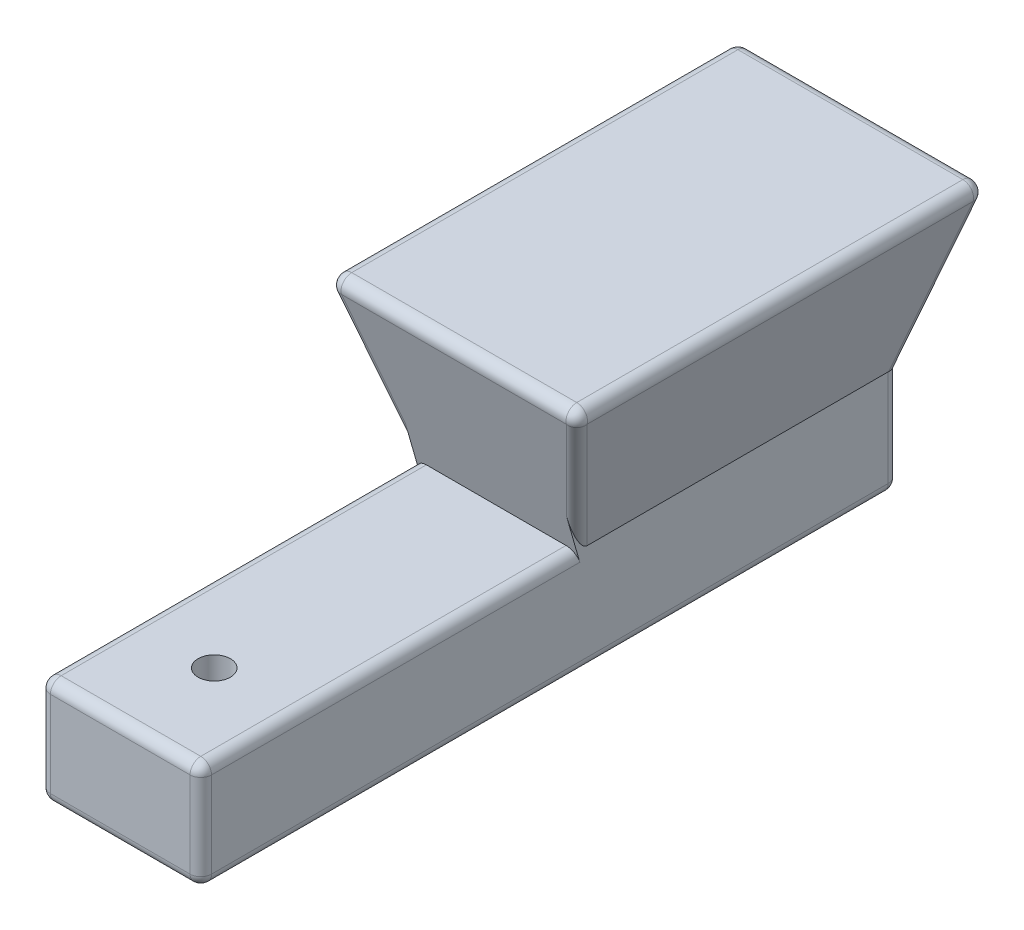
from build123d import *

# Parameters (mm, degrees)
SKETCH2_W           = 15
SKETCH2_H           = 65
BOSS_EXTRUDE1_DEPTH = 10
SKETCH3_R           = 1.5
CUT_EXTRUDE1_DEPTH  = 68.557642573
SKETCH4_W           = 15
SKETCH4_H           = 30
BOSS_EXTRUDE2_DEPTH = 15
BOSS_EXTRUDE2_DRAFT = -16
FILLET1_R           = 1
FILLET2_R           = 1
FILLET3_R           = 1
FILLET4_R           = 1


with BuildPart() as part:
    # Sketch2 → Boss-Extrude1 (new body)
    with BuildSketch(Plane(origin=(0, 0, 0), x_dir=(1, 0, 0), z_dir=(0, 1, 0))):
        with Locations((-29.80941704, 22.926008969)):
            Rectangle(SKETCH2_W, SKETCH2_H)
    extrude(amount=BOSS_EXTRUDE1_DEPTH)

    # Sketch3 → Cut-Extrude1 (cut, through all)
    with BuildSketch(Plane(origin=(0, 10, 0), x_dir=(1, 0, 0), z_dir=(0, 1, 0))):
        with Locations(Location((-29.80941704, -0.823991031, 0), (0, 0, 270))):
            Circle(SKETCH3_R)
    extrude(amount=-CUT_EXTRUDE1_DEPTH, mode=Mode.SUBTRACT)


with BuildPart() as boss_extrude2_tool:
    # Sketch4 → Boss-Extrude2 (with draft: the straight prism first)
    with BuildSketch(Plane(origin=(0, 10, 0), x_dir=(1, 0, 0), z_dir=(0, 1, 0))):
        with Locations((-29.80941704, 40.426008969)):
            Rectangle(SKETCH4_W, SKETCH4_H)
    extrude(amount=BOSS_EXTRUDE2_DEPTH)
    # Boss-Extrude2: the draft: its side faces are tilted about the plane it starts from
    boss_extrude2_sides = [boss_extrude2_tool.faces().sort_by_distance(p)[0] for p in [
        (-37.30941704, 17.5, -40.426008969),
        (-29.80941704, 17.5, -25.426008969),
        (-22.30941704, 17.5, -40.426008969),
        (-29.80941704, 17.5, -55.426008969),
    ]]
    draft(boss_extrude2_sides, Plane(origin=(0, 10, 0), x_dir=(1, 0, 0), z_dir=(0, 1, 0)), BOSS_EXTRUDE2_DRAFT)


with BuildPart() as part_1:
    add(part.part)

    # Boss-Extrude2: add boss_extrude2_tool
    add(boss_extrude2_tool.part)

    # Fillet1
    fillet1_edges = [part_1.edges().sort_by_distance(p)[0] for p in [
        (-22.30941704, 10, -7.926008969),
        (-37.30941704, 10, -7.926008969),
        (-41.610597827, 25, -40.426008969),
        (-29.80941704, 25, -21.124828182),
        (-18.008236254, 25, -40.426008969),
        (-29.80941704, 25, -59.727189755),
        (-29.80941704, 10, 9.573991031),
    ]]
    fillet(fillet1_edges, radius=FILLET1_R)

    # Fillet2
    # the kernel refuses this fillet: 1 mm, written as the material it takes off along each edge
    with BuildSketch(Plane(origin=(-23.30941704, 9, 8.573991031), x_dir=(1, 0, 0), z_dir=(0, 0, 1))) as fillet2_piece_1_section:
        Polygon((0, 0), (FILLET2_R, 0), (FILLET2_R, FILLET2_R), (0, FILLET2_R), align=None)
    fillet2_piece_1 = extrude(amount=FILLET2_R, mode=Mode.PRIVATE)
    fillet2_piece_1 = fillet2_piece_1 - Plane(origin=(-23.30941704, 9, 8.573991031), x_dir=(-0.7071067811865475, -0.7071067811865475, 0), z_dir=(0, 0, 1)) * Sphere(FILLET2_R, mode=Mode.PRIVATE)
    add(fillet2_piece_1, mode=Mode.SUBTRACT)
    with BuildSketch(Plane(origin=(-23.30941704, 1, -54.426008969), x_dir=(1, 0, 0), z_dir=(0, -1, 0))) as fillet2_piece_2_section:
        Polygon((0, 0), (FILLET2_R, 0), (FILLET2_R, -FILLET2_R), (0, -FILLET2_R), align=None)
    fillet2_piece_2 = extrude(amount=FILLET2_R, mode=Mode.PRIVATE)
    fillet2_piece_2 = fillet2_piece_2 - Plane(origin=(-23.30941704, 1, -54.426008969), x_dir=(-0.7071067811865475, 0, 0.7071067811865475), z_dir=(0, -1, 0)) * Sphere(FILLET2_R, mode=Mode.PRIVATE)
    add(fillet2_piece_2, mode=Mode.SUBTRACT)
    with BuildSketch(Plane(origin=(-22.30941704, -2.5, 9.573991031), x_dir=(-1, 0, 0), z_dir=(0, 1, 0))) as fillet2_piece_3:
        with BuildLine():
            CenterArc((FILLET2_R, -FILLET2_R), FILLET2_R, 90, 90)
            Line((0, -FILLET2_R), (0, 0))
            Line((0, 0), (FILLET2_R, 0))
        make_face()
    extrude(amount=11.5, mode=Mode.SUBTRACT)
    with BuildSketch(Plane(origin=(-39.80941704, 0, -55.426008969), x_dir=(0, 1, 0), z_dir=(1, 0, 0))) as fillet2_piece_4:
        with BuildLine():
            CenterArc((FILLET2_R, FILLET2_R), FILLET2_R, 180, 90)
            Line((0, FILLET2_R), (0, 0))
            Line((0, 0), (FILLET2_R, 0))
        make_face()
    extrude(amount=16.5, mode=Mode.SUBTRACT)
    with BuildSketch(Plane(origin=(-22.30941704, 0, -54.426008969), x_dir=(-1, 0, 0), z_dir=(0, 0, 1))) as fillet2_piece_5:
        with BuildLine():
            CenterArc((FILLET2_R, -FILLET2_R), FILLET2_R, 90, 90)
            Line((0, -FILLET2_R), (0, 0))
            Line((0, 0), (FILLET2_R, 0))
        make_face()
    extrude(amount=66.5, mode=Mode.SUBTRACT)
    with BuildSketch(Plane(origin=(-37.30941704, -2.5, -55.426008969), x_dir=(0, 0, 1), z_dir=(0, 1, 0))) as fillet2_piece_6_section:
        with BuildLine():
            CenterArc((FILLET2_R, FILLET2_R), FILLET2_R, 180, 90)
            Line((0, FILLET2_R), (0, 0))
            Line((0, 0), (FILLET2_R, 0))
        make_face()
    fillet2_piece_6 = extrude(amount=15, mode=Mode.PRIVATE)
    fillet2_piece_6 = split(fillet2_piece_6, bisect_by=Plane(origin=(-33.997421639, -1.550300601, -55.426008969), z_dir=(-0.9612616959383189, -0.2756373558169994, 0)), keep=Keep.TOP, mode=Mode.PRIVATE)
    fillet2_piece_6 = split(fillet2_piece_6, bisect_by=Plane(origin=(-37.30941704, -1.550300601, -52.114013567), z_dir=(0, -0.2756373558169994, -0.9612616959383189)), keep=Keep.TOP, mode=Mode.PRIVATE)
    add(fillet2_piece_6, mode=Mode.SUBTRACT)
    with BuildSketch(Plane(origin=(-37.30941704, -2.5, -55.426008969), x_dir=(0, 0, 1), z_dir=(0, 1, 0))) as fillet2_piece_7_section:
        with BuildLine():
            CenterArc((FILLET2_R, FILLET2_R), FILLET2_R, 180, 90)
            Line((0, FILLET2_R), (0, 0))
            Line((0, 0), (FILLET2_R, 0))
        make_face()
    fillet2_piece_7 = extrude(amount=15, mode=Mode.PRIVATE)
    fillet2_piece_7 = split(fillet2_piece_7, bisect_by=Plane(origin=(-33.997421639, -1.550300601, -55.426008969), z_dir=(0.9612616959383189, 0.2756373558169994, 0)), keep=Keep.TOP, mode=Mode.PRIVATE)
    fillet2_piece_7 = split(fillet2_piece_7, bisect_by=Plane(origin=(-37.30941704, -1.550300601, -52.114013567), z_dir=(0, -0.2756373558169994, -0.9612616959383189)), keep=Keep.TOP, mode=Mode.PRIVATE)
    add(fillet2_piece_7, mode=Mode.SUBTRACT)
    with BuildSketch(Plane(origin=(-37.30941704, -2.5, -55.426008969), x_dir=(0, 0, 1), z_dir=(0, 1, 0))) as fillet2_piece_8_section:
        with BuildLine():
            CenterArc((FILLET2_R, FILLET2_R), FILLET2_R, 180, 90)
            Line((0, FILLET2_R), (0, 0))
            Line((0, 0), (FILLET2_R, 0))
        make_face()
    fillet2_piece_8 = extrude(amount=15, mode=Mode.PRIVATE)
    fillet2_piece_8 = split(fillet2_piece_8, bisect_by=Plane(origin=(-33.997421639, -1.550300601, -55.426008969), z_dir=(-0.9612616959383189, -0.2756373558169994, 0)), keep=Keep.TOP, mode=Mode.PRIVATE)
    fillet2_piece_8 = split(fillet2_piece_8, bisect_by=Plane(origin=(-37.30941704, -1.550300601, -52.114013567), z_dir=(0, 0.2756373558169994, 0.9612616959383189)), keep=Keep.TOP, mode=Mode.PRIVATE)
    add(fillet2_piece_8, mode=Mode.SUBTRACT)
    with BuildSketch(Plane(origin=(-22.30941704, 1, -55.426008969), x_dir=(-1, 0, 0), z_dir=(0, 1, 0))) as fillet2_piece_9_section:
        with BuildLine():
            CenterArc((FILLET2_R, FILLET2_R), FILLET2_R, 180, 90)
            Line((0, FILLET2_R), (0, 0))
            Line((0, 0), (FILLET2_R, 0))
        make_face()
    fillet2_piece_9 = extrude(amount=11.5, mode=Mode.PRIVATE)
    fillet2_piece_9 = split(fillet2_piece_9, bisect_by=Plane(origin=(-22.30941704, 1.683783567, -53.04137228), z_dir=(0, -0.2756373558169994, -0.9612616959383189)), keep=Keep.TOP, mode=Mode.PRIVATE)
    fillet2_piece_9 = split(fillet2_piece_9, bisect_by=Plane(origin=(-24.694053729, 1.683783567, -55.426008969), z_dir=(0.9612616959383189, -0.2756373558169994, 0)), keep=Keep.TOP, mode=Mode.PRIVATE)
    add(fillet2_piece_9, mode=Mode.SUBTRACT)
    with BuildSketch(Plane(origin=(-22.30941704, 1, -55.426008969), x_dir=(-1, 0, 0), z_dir=(0, 1, 0))) as fillet2_piece_10_section:
        with BuildLine():
            CenterArc((FILLET2_R, FILLET2_R), FILLET2_R, 180, 90)
            Line((0, FILLET2_R), (0, 0))
            Line((0, 0), (FILLET2_R, 0))
        make_face()
    fillet2_piece_10 = extrude(amount=11.5, mode=Mode.PRIVATE)
    fillet2_piece_10 = split(fillet2_piece_10, bisect_by=Plane(origin=(-22.30941704, 1.683783567, -53.04137228), z_dir=(0, 0.2756373558169994, 0.9612616959383189)), keep=Keep.TOP, mode=Mode.PRIVATE)
    fillet2_piece_10 = split(fillet2_piece_10, bisect_by=Plane(origin=(-24.694053729, 1.683783567, -55.426008969), z_dir=(0.9612616959383189, -0.2756373558169994, 0)), keep=Keep.TOP, mode=Mode.PRIVATE)
    add(fillet2_piece_10, mode=Mode.SUBTRACT)
    with BuildSketch(Plane(origin=(-22.30941704, 1, -55.426008969), x_dir=(-1, 0, 0), z_dir=(0, 1, 0))) as fillet2_piece_11_section:
        with BuildLine():
            CenterArc((FILLET2_R, FILLET2_R), FILLET2_R, 180, 90)
            Line((0, FILLET2_R), (0, 0))
            Line((0, 0), (FILLET2_R, 0))
        make_face()
    fillet2_piece_11 = extrude(amount=11.5, mode=Mode.PRIVATE)
    fillet2_piece_11 = split(fillet2_piece_11, bisect_by=Plane(origin=(-22.30941704, 1.683783567, -53.04137228), z_dir=(0, -0.2756373558169994, -0.9612616959383189)), keep=Keep.TOP, mode=Mode.PRIVATE)
    fillet2_piece_11 = split(fillet2_piece_11, bisect_by=Plane(origin=(-24.694053729, 1.683783567, -55.426008969), z_dir=(-0.9612616959383189, 0.2756373558169994, 0)), keep=Keep.TOP, mode=Mode.PRIVATE)
    add(fillet2_piece_11, mode=Mode.SUBTRACT)

    # Fillet3
    # the kernel refuses this fillet: 1 mm, written as the material it takes off along each edge
    with BuildSketch(Plane(origin=(-36.30941704, 9, 8.573991031), x_dir=(-1, 0, 0), z_dir=(0, 0, 1))) as fillet3_piece_1_section:
        Polygon((0, 0), (FILLET3_R, 0), (FILLET3_R, -FILLET3_R), (0, -FILLET3_R), align=None)
    fillet3_piece_1 = extrude(amount=FILLET3_R, mode=Mode.PRIVATE)
    fillet3_piece_1 = fillet3_piece_1 - Plane(origin=(-36.30941704, 9, 8.573991031), x_dir=(0.7071067811865475, -0.7071067811865475, 0), z_dir=(0, 0, 1)) * Sphere(FILLET3_R, mode=Mode.PRIVATE)
    add(fillet3_piece_1, mode=Mode.SUBTRACT)
    with BuildSketch(Plane(origin=(-36.30941704, 1, -54.426008969), x_dir=(-1, 0, 0), z_dir=(0, -1, 0))) as fillet3_piece_2_section:
        Polygon((0, 0), (FILLET3_R, 0), (FILLET3_R, FILLET3_R), (0, FILLET3_R), align=None)
    fillet3_piece_2 = extrude(amount=FILLET3_R, mode=Mode.PRIVATE)
    fillet3_piece_2 = fillet3_piece_2 - Plane(origin=(-36.30941704, 1, -54.426008969), x_dir=(0.7071067811865475, 0, 0.7071067811865475), z_dir=(0, -1, 0)) * Sphere(FILLET3_R, mode=Mode.PRIVATE)
    add(fillet3_piece_2, mode=Mode.SUBTRACT)
    with BuildSketch(Plane(origin=(-23.30941704, 1, 8.573991031), x_dir=(0, 0, 1), z_dir=(0, -1, 0))) as fillet3_piece_3_section:
        Polygon((0, 0), (FILLET3_R, 0), (FILLET3_R, -FILLET3_R), (0, -FILLET3_R), align=None)
    fillet3_piece_3 = extrude(amount=FILLET3_R, mode=Mode.PRIVATE)
    fillet3_piece_3 = fillet3_piece_3 - Plane(origin=(-23.30941704, 1, 8.573991031), x_dir=(-0.7071067811865476, 0, -0.7071067811865475), z_dir=(0, -1, 0)) * Sphere(FILLET3_R, mode=Mode.PRIVATE)
    add(fillet3_piece_3, mode=Mode.SUBTRACT)
    with BuildSketch(Plane(origin=(-36.30941704, 1, 8.573991031), x_dir=(0, 0, 1), z_dir=(-1, 0, 0))) as fillet3_piece_4_section:
        Polygon((0, 0), (FILLET3_R, 0), (FILLET3_R, -FILLET3_R), (0, -FILLET3_R), align=None)
    fillet3_piece_4 = extrude(amount=FILLET3_R, mode=Mode.PRIVATE)
    fillet3_piece_4 = fillet3_piece_4 - Plane(origin=(-36.30941704, 1, 8.573991031), x_dir=(0, 0.7071067811865475, -0.7071067811865475), z_dir=(-1, 0, 0)) * Sphere(FILLET3_R, mode=Mode.PRIVATE)
    add(fillet3_piece_4, mode=Mode.SUBTRACT)
    with BuildSketch(Plane(origin=(-37.30941704, 1, 9.573991031), x_dir=(1, 0, 0), z_dir=(0, 1, 0))) as fillet3_piece_5:
        with BuildLine():
            CenterArc((FILLET3_R, FILLET3_R), FILLET3_R, 180, 90)
            Line((0, FILLET3_R), (0, 0))
            Line((0, 0), (FILLET3_R, 0))
        make_face()
    extrude(amount=8, mode=Mode.SUBTRACT)
    with BuildSketch(Plane(origin=(-23.30941704, 0, 9.573991031), x_dir=(0, 0, -1), z_dir=(-1, 0, 0))) as fillet3_piece_6:
        with BuildLine():
            CenterArc((FILLET3_R, -FILLET3_R), FILLET3_R, 90, 90)
            Line((0, -FILLET3_R), (0, 0))
            Line((0, 0), (FILLET3_R, 0))
        make_face()
    extrude(amount=13, mode=Mode.SUBTRACT)
    with BuildSketch(Plane(origin=(-37.30941704, 0, 8.573991031), x_dir=(1, 0, 0), z_dir=(0, 0, -1))) as fillet3_piece_7:
        with BuildLine():
            CenterArc((FILLET3_R, -FILLET3_R), FILLET3_R, 90, 90)
            Line((0, -FILLET3_R), (0, 0))
            Line((0, 0), (FILLET3_R, 0))
        make_face()
    extrude(amount=63, mode=Mode.SUBTRACT)

    # Fillet4
    # the kernel refuses this fillet: 1 mm, written as the material it takes off along each edge
    with BuildSketch(Plane(origin=(-19.335281076, 24, -58.400144933), x_dir=(-0.586629189217781, 0.7784832277628361, -0.22322647345161653), z_dir=(0.6714721557028178, 0.31344902014780923, -0.6714721557028178))) as fillet4_piece_1_section:
        Polygon((-2.551826428, -2.551826428), (2.551826428, -2.551826428), (2.551826428, 2.551826428), (-2.551826428, 2.551826428), align=None)
    fillet4_piece_1 = extrude(amount=2.551826428, mode=Mode.PRIVATE)
    fillet4_piece_1 = split(fillet4_piece_1, bisect_by=Plane(origin=(-19.335281076, 24, -58.400144933), z_dir=(0.265727678029987, 0.9267025424900824, -0.265727678029987)), keep=Keep.TOP, mode=Mode.PRIVATE)
    fillet4_piece_1 = split(fillet4_piece_1, bisect_by=Plane(origin=(-19.335281076, 24, -58.400144933), z_dir=(0, 0, -1)), keep=Keep.TOP, mode=Mode.PRIVATE)
    fillet4_piece_1 = split(fillet4_piece_1, bisect_by=Plane(origin=(-19.335281076, 24, -58.400144933), z_dir=(1, 0, 0)), keep=Keep.TOP, mode=Mode.PRIVATE)
    fillet4_piece_1 = split(fillet4_piece_1, bisect_by=Plane(origin=(-19.335281076, 23.724362644, -59.361406629), z_dir=(0, 0.2756373558169994, 0.9612616959383189)), keep=Keep.TOP, mode=Mode.PRIVATE)
    fillet4_piece_1 = split(fillet4_piece_1, bisect_by=Plane(origin=(-18.37401938, 23.724362644, -58.400144933), z_dir=(-0.9612616959383189, 0.2756373558169994, 0)), keep=Keep.TOP, mode=Mode.PRIVATE)
    fillet4_piece_1 = split(fillet4_piece_1, bisect_by=Plane(origin=(-19.335281076, 25, -58.400144933), z_dir=(0, -1, 0)), keep=Keep.TOP, mode=Mode.PRIVATE)
    fillet4_piece_1 = fillet4_piece_1 - Plane(origin=(-19.335281076, 24, -58.400144933), x_dir=(-0.6714721557028178, -0.31344902014780923, 0.6714721557028178), z_dir=(-0.586629189217781, 0.7784832277628361, -0.22322647345161653)) * Sphere(FILLET4_R, mode=Mode.PRIVATE)
    add(fillet4_piece_1, mode=Mode.SUBTRACT)
    with BuildSketch(Plane(origin=(-19.335281076, 24, -22.451873004), x_dir=(0.586629189217781, -0.7784832277628361, -0.22322647345161653), z_dir=(0.6714721557028178, 0.31344902014780923, 0.6714721557028178))) as fillet4_piece_2_section:
        Polygon((-2.551826428, -2.551826428), (2.551826428, -2.551826428), (2.551826428, 2.551826428), (-2.551826428, 2.551826428), align=None)
    fillet4_piece_2 = extrude(amount=2.551826428, mode=Mode.PRIVATE)
    fillet4_piece_2 = split(fillet4_piece_2, bisect_by=Plane(origin=(-19.335281076, 24, -22.451873004), z_dir=(0.265727678029987, 0.9267025424900824, 0.265727678029987)), keep=Keep.TOP, mode=Mode.PRIVATE)
    fillet4_piece_2 = split(fillet4_piece_2, bisect_by=Plane(origin=(-19.335281076, 24, -22.451873004), z_dir=(0, 0, 1)), keep=Keep.TOP, mode=Mode.PRIVATE)
    fillet4_piece_2 = split(fillet4_piece_2, bisect_by=Plane(origin=(-19.335281076, 24, -22.451873004), z_dir=(1, 0, 0)), keep=Keep.TOP, mode=Mode.PRIVATE)
    fillet4_piece_2 = split(fillet4_piece_2, bisect_by=Plane(origin=(-19.335281076, 23.724362644, -21.490611308), z_dir=(0, 0.2756373558169994, -0.9612616959383189)), keep=Keep.TOP, mode=Mode.PRIVATE)
    fillet4_piece_2 = split(fillet4_piece_2, bisect_by=Plane(origin=(-18.37401938, 23.724362644, -22.451873004), z_dir=(-0.9612616959383189, 0.2756373558169994, 0)), keep=Keep.TOP, mode=Mode.PRIVATE)
    fillet4_piece_2 = split(fillet4_piece_2, bisect_by=Plane(origin=(-19.335281076, 25, -22.451873004), z_dir=(0, -1, 0)), keep=Keep.TOP, mode=Mode.PRIVATE)
    fillet4_piece_2 = fillet4_piece_2 - Plane(origin=(-19.335281076, 24, -22.451873004), x_dir=(-0.6714721557028178, -0.31344902014780923, -0.6714721557028178), z_dir=(0.586629189217781, -0.7784832277628361, -0.22322647345161653)) * Sphere(FILLET4_R, mode=Mode.PRIVATE)
    add(fillet4_piece_2, mode=Mode.SUBTRACT)
    with BuildSketch(Plane(origin=(-40.283553005, 24, -22.451873004), x_dir=(0.22322647345161664, -0.7784832277628361, 0.5866291892177808), z_dir=(-0.6714721557028177, 0.3134490201478092, 0.6714721557028178))) as fillet4_piece_3_section:
        Polygon((-2.551826428, -2.551826428), (2.551826428, -2.551826428), (2.551826428, 2.551826428), (-2.551826428, 2.551826428), align=None)
    fillet4_piece_3 = extrude(amount=2.551826428, mode=Mode.PRIVATE)
    fillet4_piece_3 = split(fillet4_piece_3, bisect_by=Plane(origin=(-40.283553005, 24, -22.451873004), z_dir=(-0.2657276780299869, 0.9267025424900824, 0.265727678029987)), keep=Keep.TOP, mode=Mode.PRIVATE)
    fillet4_piece_3 = split(fillet4_piece_3, bisect_by=Plane(origin=(-40.283553005, 24, -22.451873004), z_dir=(-1, 0, 0)), keep=Keep.TOP, mode=Mode.PRIVATE)
    fillet4_piece_3 = split(fillet4_piece_3, bisect_by=Plane(origin=(-40.283553005, 24, -22.451873004), z_dir=(0, 0, 1)), keep=Keep.TOP, mode=Mode.PRIVATE)
    fillet4_piece_3 = split(fillet4_piece_3, bisect_by=Plane(origin=(-41.244814701, 23.724362644, -22.451873004), z_dir=(0.9612616959383189, 0.2756373558169994, 0)), keep=Keep.TOP, mode=Mode.PRIVATE)
    fillet4_piece_3 = split(fillet4_piece_3, bisect_by=Plane(origin=(-40.283553005, 23.724362644, -21.490611308), z_dir=(0, 0.2756373558169994, -0.9612616959383189)), keep=Keep.TOP, mode=Mode.PRIVATE)
    fillet4_piece_3 = split(fillet4_piece_3, bisect_by=Plane(origin=(-40.283553005, 25, -22.451873004), z_dir=(0, -1, 0)), keep=Keep.TOP, mode=Mode.PRIVATE)
    fillet4_piece_3 = fillet4_piece_3 - Plane(origin=(-40.283553005, 24, -22.451873004), x_dir=(0.6714721557028177, -0.3134490201478092, -0.6714721557028178), z_dir=(0.22322647345161664, -0.7784832277628361, 0.5866291892177808)) * Sphere(FILLET4_R, mode=Mode.PRIVATE)
    add(fillet4_piece_3, mode=Mode.SUBTRACT)
    with BuildSketch(Plane(origin=(-40.283553005, 24, -58.400144933), x_dir=(-0.22322647345161636, 0.778483227762836, 0.586629189217781), z_dir=(-0.6714721557028179, 0.3134490201478093, -0.6714721557028177))) as fillet4_piece_4_section:
        Polygon((-2.551826428, -2.551826428), (2.551826428, -2.551826428), (2.551826428, 2.551826428), (-2.551826428, 2.551826428), align=None)
    fillet4_piece_4 = extrude(amount=2.551826428, mode=Mode.PRIVATE)
    fillet4_piece_4 = split(fillet4_piece_4, bisect_by=Plane(origin=(-40.283553005, 24, -58.400144933), z_dir=(-0.26572767802998704, 0.9267025424900824, -0.265727678029987)), keep=Keep.TOP, mode=Mode.PRIVATE)
    fillet4_piece_4 = split(fillet4_piece_4, bisect_by=Plane(origin=(-40.283553005, 24, -58.400144933), z_dir=(-1, 0, 0)), keep=Keep.TOP, mode=Mode.PRIVATE)
    fillet4_piece_4 = split(fillet4_piece_4, bisect_by=Plane(origin=(-40.283553005, 24, -58.400144933), z_dir=(0, 0, -1)), keep=Keep.TOP, mode=Mode.PRIVATE)
    fillet4_piece_4 = split(fillet4_piece_4, bisect_by=Plane(origin=(-41.244814701, 23.724362644, -58.400144933), z_dir=(0.9612616959383189, 0.2756373558169994, 0)), keep=Keep.TOP, mode=Mode.PRIVATE)
    fillet4_piece_4 = split(fillet4_piece_4, bisect_by=Plane(origin=(-40.283553005, 23.724362644, -59.361406629), z_dir=(0, 0.2756373558169994, 0.9612616959383189)), keep=Keep.TOP, mode=Mode.PRIVATE)
    fillet4_piece_4 = split(fillet4_piece_4, bisect_by=Plane(origin=(-40.283553005, 25, -58.400144933), z_dir=(0, -1, 0)), keep=Keep.TOP, mode=Mode.PRIVATE)
    fillet4_piece_4 = fillet4_piece_4 - Plane(origin=(-40.283553005, 24, -58.400144933), x_dir=(0.6714721557028179, -0.3134490201478093, 0.6714721557028177), z_dir=(-0.22322647345161636, 0.778483227762836, 0.586629189217781)) * Sphere(FILLET4_R, mode=Mode.PRIVATE)
    add(fillet4_piece_4, mode=Mode.SUBTRACT)
    with BuildSketch(Plane(origin=(-18.44189522, 23.487651457, -59.293530789), x_dir=(-0.9640481321639595, 0.25543383844084533, -0.07324447453942981), z_dir=(-0.26572767802993547, -0.9267025424901008, 0.26572767802997477))) as fillet4_piece_5_section:
        with BuildLine():
            CenterArc((FILLET4_R * 0.92670254249, -FILLET4_R), FILLET4_R, 90, 85.64269976)
            Line((-FILLET4_R * 0.0704071078139, -FILLET4_R * 0.924024048078), (0, 0))
            Line((0, 0), (FILLET4_R * 0.92670254249, 0))
        make_face()
    fillet4_piece_5 = extrude(amount=17.973443193, mode=Mode.PRIVATE)
    fillet4_piece_5 = fillet4_piece_5 - Plane(origin=(-23.30941704, 23.487651457, -54.426008969), x_dir=(-1, 0, 0), z_dir=(0, -1, 0)) * Cylinder(1, 40, mode=Mode.PRIVATE)
    add(fillet4_piece_5, mode=Mode.SUBTRACT)
    with BuildSketch(Plane(origin=(-22.925043327, 7.853055994, -26.041635256), x_dir=(-0.9640481321639451, 0.2554338384408567, 0.07324447453957714), z_dir=(0.26572767802998704, 0.9267025424900825, 0.26572767802998704))) as fillet4_piece_6_section:
        with BuildLine():
            CenterArc((FILLET4_R * 0.92670254249, -FILLET4_R), FILLET4_R, 90, 85.64269976)
            Line((-FILLET4_R * 0.070407107814, -FILLET4_R * 0.924024048078), (0, 0))
            Line((0, 0), (FILLET4_R * 0.92670254249, 0))
        make_face()
    fillet4_piece_6 = extrude(amount=16.871212439, mode=Mode.PRIVATE)
    fillet4_piece_6 = split(fillet4_piece_6, bisect_by=Plane(origin=(-22.30941704, 7.853055994, -26.041635256), z_dir=(1, 0, 0)), keep=Keep.TOP, mode=Mode.PRIVATE)
    add(fillet4_piece_6, mode=Mode.SUBTRACT)
    with BuildSketch(Plane(origin=(-36.693790753, 7.853055994, -26.041635256), x_dir=(-0.07324447453957462, 0.25543383844085743, -0.9640481321639451), z_dir=(-0.265727678029987, 0.9267025424900825, 0.26572767802998704))) as fillet4_piece_7_section:
        with BuildLine():
            CenterArc((FILLET4_R * 0.92670254249, -FILLET4_R), FILLET4_R, 90, 85.64269976)
            Line((-FILLET4_R * 0.070407107814, -FILLET4_R * 0.924024048078), (0, 0))
            Line((0, 0), (FILLET4_R * 0.92670254249, 0))
        make_face()
    fillet4_piece_7 = extrude(amount=16.871212439, mode=Mode.PRIVATE)
    fillet4_piece_7 = split(fillet4_piece_7, bisect_by=Plane(origin=(-37.30941704, 7.853055994, -26.041635256), z_dir=(-1, 0, 0)), keep=Keep.TOP, mode=Mode.PRIVATE)
    add(fillet4_piece_7, mode=Mode.SUBTRACT)
    with BuildSketch(Plane(origin=(-41.17693886, 23.487651457, -59.293530789), x_dir=(-0.073244474539126, 0.25543383844094353, 0.9640481321639565), z_dir=(0.2657276780299394, -0.9267025424901079, 0.2657276780299461))) as fillet4_piece_8_section:
        with BuildLine():
            CenterArc((FILLET4_R * 0.926702542491, -FILLET4_R), FILLET4_R, 90, 85.64269976)
            Line((-FILLET4_R * 0.0704071078136, -FILLET4_R * 0.924024048078), (0, 0))
            Line((0, 0), (FILLET4_R * 0.92670254249, 0))
        make_face()
    fillet4_piece_8 = extrude(amount=17.973443193, mode=Mode.PRIVATE)
    fillet4_piece_8 = fillet4_piece_8 - Plane(origin=(-36.30941704, 23.487651457, -54.426008969), x_dir=(0, 0, 1), z_dir=(0, -1, 0)) * Cylinder(1, 40, mode=Mode.PRIVATE)
    add(fillet4_piece_8, mode=Mode.SUBTRACT)


solid = part_1.part
